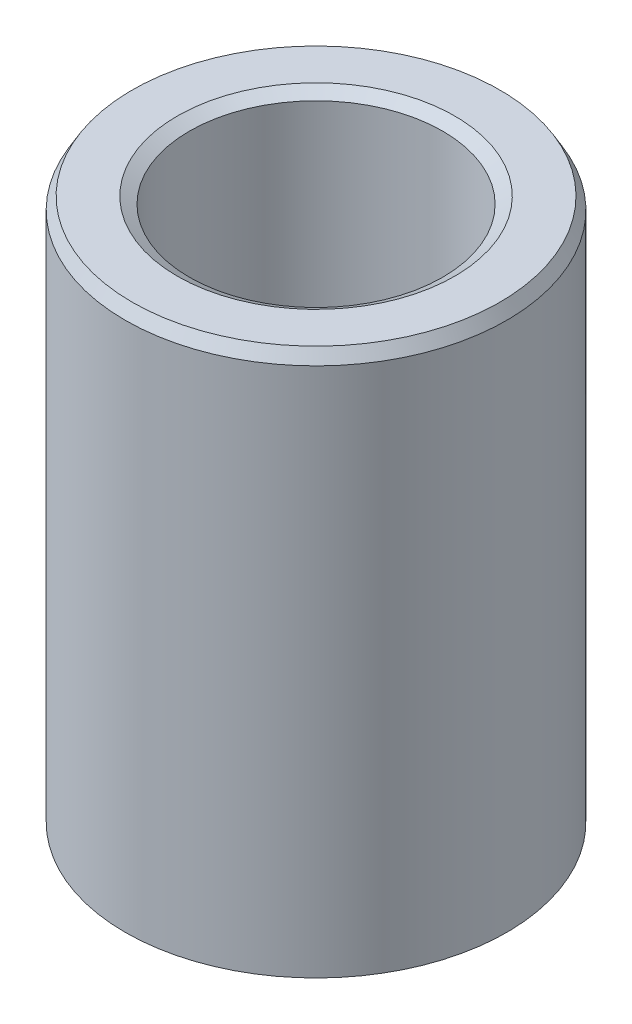
from build123d import *
from OCP.BRepFilletAPI import BRepFilletAPI_MakeChamfer

# Parameters (mm, degrees)
SKETCH1_R           = 32.5
BOSS_EXTRUDE1_DEPTH = 93.53568383
SKETCH2_R           = 21.566057351
CUT_EXTRUDE1_DEPTH  = 105.218156525
CHAMFER1_SIZE       = 2.066442335
CHAMFER1_SIZE2      = 1.193061038


with BuildPart() as part:
    # Sketch1 → Boss-Extrude1 (new body)
    with BuildSketch(Plane(origin=(0, 0, 0), x_dir=(1, 0, 0), z_dir=(0, 1, 0))):
        Circle(SKETCH1_R)
    extrude(amount=BOSS_EXTRUDE1_DEPTH)

    # Sketch2 → Cut-Extrude1 (cut, through all)
    with BuildSketch(Plane(origin=(0, 0, 0), x_dir=(1, 0, 0), z_dir=(0, 1, 0))):
        Circle(SKETCH2_R)
    extrude(amount=CUT_EXTRUDE1_DEPTH, mode=Mode.SUBTRACT)

    # Chamfer1: one chamfer whose edges measure the first distance from different faces: ONE call of the kernel's chamfer builder (chamfer() names one face for all edges)
    chamfer1_edges_1 = [part.edges().sort_by_distance(p)[0] for p in [
        (-21.566057351, 93.53568383, 0),
    ]]
    chamfer1_side_1 = [part.faces().sort_by_distance(p)[0] for p in [
        (-31.580761184, 93.53568383, 0),
    ]]
    chamfer1_edges_2 = [part.edges().sort_by_distance(p)[0] for p in [
        (-21.566057351, 0, 0),
    ]]
    chamfer1_side_2 = [part.faces().sort_by_distance(p)[0] for p in [
        (-21.566057351, 46.767841915, 0),
    ]]
    chamfer1_edges_3 = [part.edges().sort_by_distance(p)[0] for p in [
        (-32.5, 0, 0),
    ]]
    chamfer1_side_3 = [part.faces().sort_by_distance(p)[0] for p in [
        (-31.580761184, 0, 0),
    ]]
    chamfer1_edges_4 = [part.edges().sort_by_distance(p)[0] for p in [
        (-32.5, 93.53568383, 0),
    ]]
    chamfer1_side_4 = [part.faces().sort_by_distance(p)[0] for p in [
        (-32.5, 46.767841915, 0),
    ]]
    chamfer1 = BRepFilletAPI_MakeChamfer(part.part.solid().wrapped)
    for e in chamfer1_edges_1:
        chamfer1.Add(CHAMFER1_SIZE, CHAMFER1_SIZE2, e.wrapped, chamfer1_side_1[0].wrapped)  # the first distance lies on this face
    for e in chamfer1_edges_2:
        chamfer1.Add(CHAMFER1_SIZE, CHAMFER1_SIZE2, e.wrapped, chamfer1_side_2[0].wrapped)  # the first distance lies on this face
    for e in chamfer1_edges_3:
        chamfer1.Add(CHAMFER1_SIZE, CHAMFER1_SIZE2, e.wrapped, chamfer1_side_3[0].wrapped)  # the first distance lies on this face
    for e in chamfer1_edges_4:
        chamfer1.Add(CHAMFER1_SIZE, CHAMFER1_SIZE2, e.wrapped, chamfer1_side_4[0].wrapped)  # the first distance lies on this face
    add(Compound.cast(chamfer1.Shape()), mode=Mode.REPLACE)


solid = part.part
